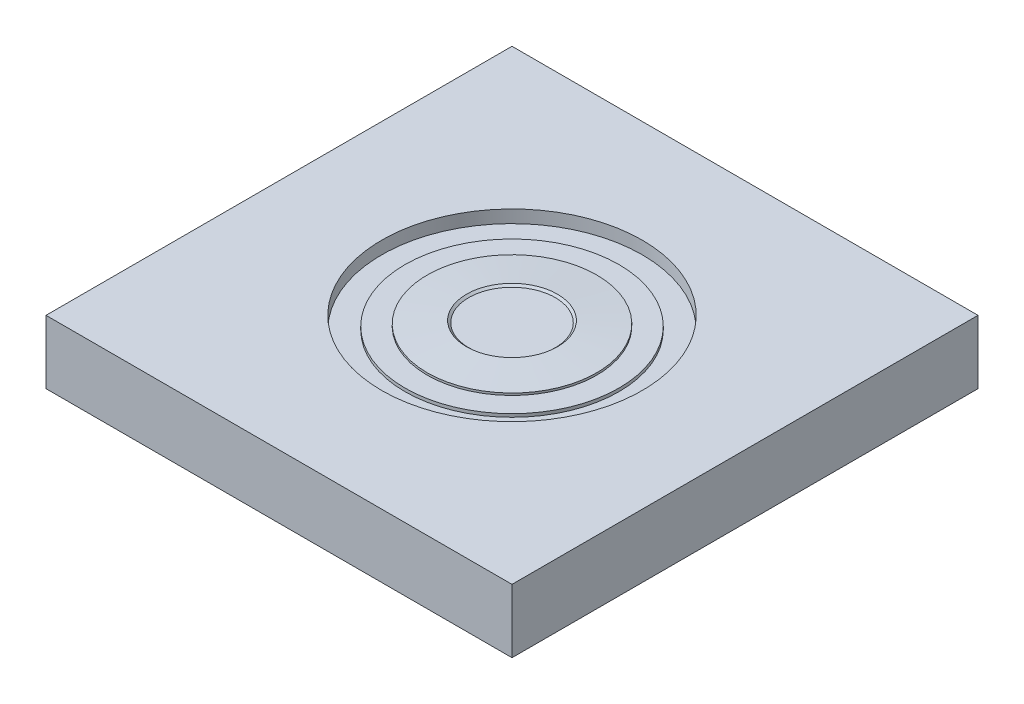
from build123d import *

# Parameters (mm, degrees)
SKETCH1_W           = 220
SKETCH1_H           = 220
BOSS_EXTRUDE1_DEPTH = 30
SKETCH2_R           = 61.5
SKETCH2_R_2         = 50.5
CUT_EXTRUDE1_DEPTH  = 6
SKETCH3_R           = 50.5
SKETCH3_R_2         = 40
CUT_EXTRUDE2_DEPTH  = 4.5
SKETCH4_R           = 40
CUT_EXTRUDE3_DEPTH  = 3.5
SKETCH5_R           = 40
SKETCH6_R           = 20
SKETCH8_R           = 20
CUT_EXTRUDE4_DEPTH  = 1
CHAMFER1_SIZE       = 1.5
CHAMFER1_SIZE_2     = 1.399267753


with BuildPart() as part:
    # Sketch1 → Boss-Extrude1 (new body)
    with BuildSketch(Plane(origin=(0, 0, 0), x_dir=(1, 0, 0), z_dir=(0, 1, 0))):
        Rectangle(SKETCH1_W, SKETCH1_H)
    extrude(amount=BOSS_EXTRUDE1_DEPTH)

    # Sketch2 → Cut-Extrude1 (cut)
    with BuildSketch(Plane(origin=(0, 30, 0), x_dir=(1, 0, 0), z_dir=(0, 1, 0))):
        with Locations(Location((0, 0, 0), (0, 0, 270))):
            Circle(SKETCH2_R)
        with Locations(Location((0, 0, 0), (0, 0, 270))):
            Circle(SKETCH2_R_2, mode=Mode.SUBTRACT)
    extrude(amount=-CUT_EXTRUDE1_DEPTH, mode=Mode.SUBTRACT)

    # Sketch3 → Cut-Extrude2 (cut)
    with BuildSketch(Plane(origin=(0, 30, 0), x_dir=(1, 0, 0), z_dir=(0, 1, 0))):
        with Locations(Location((0, 0, 0), (0, 0, 270))):
            Circle(SKETCH3_R)
        with Locations(Location((0, 0, 0), (0, 0, 270))):
            Circle(SKETCH3_R_2, mode=Mode.SUBTRACT)
    extrude(amount=-CUT_EXTRUDE2_DEPTH, mode=Mode.SUBTRACT)

    # Sketch4 → Cut-Extrude3 (cut)
    with BuildSketch(Plane(origin=(0, 30, 0), x_dir=(1, 0, 0), z_dir=(0, 1, 0))):
        with Locations(Location((0, 0, 0), (0, 0, 270))):
            Circle(SKETCH4_R)
    extrude(amount=-CUT_EXTRUDE3_DEPTH, mode=Mode.SUBTRACT)

    # Sketch5 → Loft1 section 0
    with BuildSketch(Plane(origin=(0, 26.5, 0), x_dir=(1, 0, 0), z_dir=(0, 1, 0))):
        Circle(SKETCH5_R)
    # Sketch6 → Loft1 section 1
    with BuildSketch(Plane(origin=(0, 28, 0), x_dir=(1, 0, 0), z_dir=(0, 1, 0))):
        Circle(SKETCH6_R)
    loft()

    # Sketch8 → Cut-Extrude4 (cut)
    with BuildSketch(Plane(origin=(0, 28, 0), x_dir=(1, 0, 0), z_dir=(0, 1, 0))):
        with Locations(Location((0, 0, 0), (0, 0, 270))):
            Circle(SKETCH8_R)
    extrude(amount=-CUT_EXTRUDE4_DEPTH, mode=Mode.SUBTRACT)

    # Chamfer1
    # the kernel refuses this chamfer: 1.5, 1.399267753 mm, written as the material it takes off along each edge
    with BuildSketch(Plane(origin=(0, 28, 0), x_dir=(1, 0, 0), z_dir=(0, 0, 1))) as chamfer1_piece_1_section:
        Polygon((20 + CHAMFER1_SIZE * 0.997199309888, -CHAMFER1_SIZE * 0.0747899482416), (20, -CHAMFER1_SIZE_2), (20, 0), align=None)
    chamfer1_piece_1 = revolve(axis=Axis((0, 28, 0), (0, 1, 0)), revolution_arc=270, mode=Mode.PRIVATE)
    chamfer1_piece_1 = split(chamfer1_piece_1, bisect_by=Plane(origin=(-14.829664254, 27, -14.829664254), z_dir=(0, 1, 0)), keep=Keep.TOP, mode=Mode.PRIVATE)
    add(chamfer1_piece_1, mode=Mode.SUBTRACT)
    with BuildSketch(Plane(origin=(0, 28, 0), x_dir=(0, 0, 1), z_dir=(-1, 0, 0))) as chamfer1_piece_2_section:
        Polygon((20 + CHAMFER1_SIZE * 0.997199309888, -CHAMFER1_SIZE * 0.0747899482416), (20, -CHAMFER1_SIZE_2), (20, 0), align=None)
    chamfer1_piece_2 = revolve(axis=Axis((0, 28, 0), (0, 1, 0)), revolution_arc=90, mode=Mode.PRIVATE)
    chamfer1_piece_2 = split(chamfer1_piece_2, bisect_by=Plane(origin=(14.836241564, 27, 14.836241564), z_dir=(0, 1, 0)), keep=Keep.TOP, mode=Mode.PRIVATE)
    add(chamfer1_piece_2, mode=Mode.SUBTRACT)


solid = part.part
